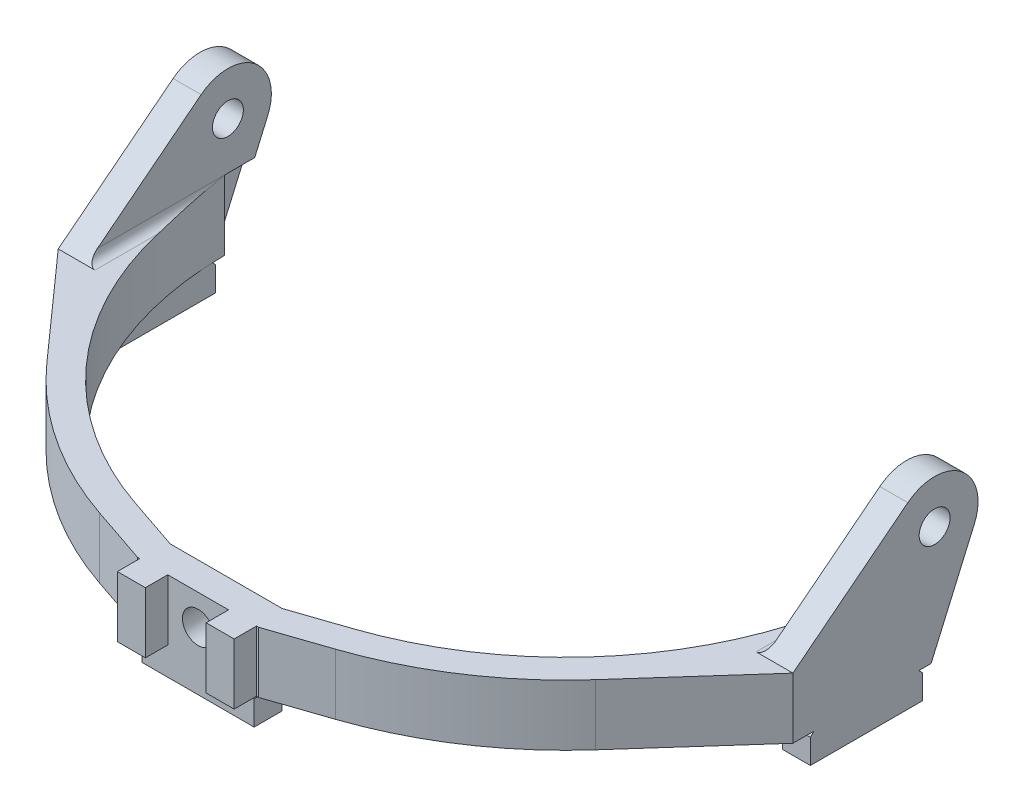
from build123d import *

# Parameters (mm, degrees)
BOSS_EXTRUDE2_DEPTH             = 6.896
SKETCH2_R                       = 1.7526
BOSS_EXTRUDE3_DEPTH             = 3.175
F_9_64_0_14063_DIAMETER_HOLE2_D = 3.572002
SKETCH9_W                       = 3.175
SKETCH9_H                       = 6.896
BOSS_EXTRUDE5_DEPTH             = 2.54
SKETCH10_W                      = 3.175
SKETCH10_H                      = 12.7
SKETCH10_W_2                    = 12.7
SKETCH10_H_2                    = 3.175
BOSS_EXTRUDE6_DEPTH             = 3.175
CUT_EXTRUDE1_DEPTH              = 97.085734956
CUT_EXTRUDE2_DEPTH              = 66.25004773
FILLET2_R                       = 1
CUT_EXTRUDE3_DEPTH              = 1


with BuildPart() as part:
    # Sketch1 → Boss-Extrude2 (new body)
    with BuildSketch(Plane(origin=(0, 0, 0), x_dir=(1, 0, 0), z_dir=(0, 1, 0))):
        with BuildLine():
            Line((12.363664128, -36.460798254), (6.35, -38.5))
            Line((6.35, -38.5), (-6.35, -38.5))
            Line((-6.35, -38.5), (-12.363664128, -36.460798254))
            ThreePointArc((-12.363664128, -36.460798254), (-27.097558937, -27.349082245), (-36.345013413, -12.7))
            ThreePointArc((-36.345013413, -12.7), (-37.940572846, -6.539337285), (-38.499480516, -0.2))
            Line((-38.499480516, -0.2), (-41.675, -0.2))
            Line((-41.675, -0.2), (-41.675, -15.875))
            Line((-41.675, -15.875), (-31.113215051, -27.726764582))
            ThreePointArc((-31.113215051, -27.726764582), (-23.009697223, -34.747078419), (-13.383265001, -39.467630318))
            Line((-13.383265001, -39.467630318), (-6.873668831, -41.675))
            Line((-6.873668831, -41.675), (6.873668831, -41.675))
            Line((6.873668831, -41.675), (13.383265001, -39.467630318))
            ThreePointArc((13.383265001, -39.467630318), (23.009697223, -34.747078419), (31.113215051, -27.726764582))
            Line((31.113215051, -27.726764582), (41.675, -15.875))
            Line((41.675, -15.875), (41.675, -0.2))
            Line((41.675, -0.2), (38.499480516, -0.2))
            ThreePointArc((38.499480516, -0.2), (37.940572846, -6.539337285), (36.345013413, -12.7))
            ThreePointArc((36.345013413, -12.7), (27.097558937, -27.349082245), (12.363664128, -36.460798254))
        make_face()
    extrude(amount=BOSS_EXTRUDE2_DEPTH)

    # Sketch2 → Boss-Extrude3 (add)
    with BuildSketch(Plane(origin=(41.675, 0, 0), x_dir=(0, 0, -1), z_dir=(1, 0, 0))):
        with BuildLine():
            Line((-15.875, 6.896), (-2.841859979, 17.12263896))
            ThreePointArc((-2.841859979, 17.12263896), (3.214674972, 17.143816898), (4.716891749, 11.27649989))
            Line((4.716891749, 11.27649989), (-0.2, 0))
            Line((-0.2, 0), (-0.2, 6.896))
            Line((-0.2, 6.896), (-15.875, 6.896))
        make_face()
        with Locations((0.2, 13.246)):
            Circle(SKETCH2_R, mode=Mode.SUBTRACT)
    boss_extrude3 = extrude(amount=-BOSS_EXTRUDE3_DEPTH)

    # Mirror1: Boss-Extrude3 across plane
    add(boss_extrude3.mirror(Plane.ZY))

    # 9/64 (0.14063) Diameter Hole2 (through all)
    with Locations(Plane.XY.offset(41.675)):
        with Locations((0, 3.448)):
            Hole(F_9_64_0_14063_DIAMETER_HOLE2_D / 2)

    # Sketch9 → Boss-Extrude5 (add)
    with BuildSketch(Plane.XY.offset(41.675)):
        with Locations((-5.0355, 3.448)):
            Rectangle(SKETCH9_W, SKETCH9_H)
        with Locations((5.0355, 3.448)):
            Rectangle(SKETCH9_W, SKETCH9_H)
    extrude(amount=BOSS_EXTRUDE5_DEPTH)

    # Sketch10 → Boss-Extrude6 (add)
    with BuildSketch(Plane(origin=(0, 0, 0), x_dir=(-1, 0, 0), z_dir=(0, -1, 0))):
        with Locations((40.0875, -7.545458209)):
            Rectangle(SKETCH10_W, SKETCH10_H)
        with Locations((-40.0875, -7.545458209)):
            Rectangle(SKETCH10_W, SKETCH10_H)
        with Locations((0, -40.0875)):
            Rectangle(SKETCH10_W_2, SKETCH10_H_2)
    extrude(amount=BOSS_EXTRUDE6_DEPTH)

    # Sketch11 → Cut-Extrude1 (cut, through all)
    with BuildSketch(Plane.ZY.offset(41.675)):
        Polygon((13.895458209, -0.4), (13.495458209, 0), (13.895458209, 0), align=None)
        Polygon((1.595458209, 0), (1.195458209, 0), (1.195458209, -0.4), align=None)
    extrude(amount=-CUT_EXTRUDE1_DEPTH, mode=Mode.SUBTRACT)

    # Sketch12 → Cut-Extrude2 (cut, through all)
    with BuildSketch(Plane.XY.offset(41.675)):
        Polygon((6.35, -0.4), (6.35, 0), (5.95, 0), align=None)
        Polygon((-5.95, 0), (-6.35, -0.4), (-6.35, 0), align=None)
    extrude(amount=-CUT_EXTRUDE2_DEPTH, mode=Mode.SUBTRACT)

    # Fillet2
    # the kernel refuses this fillet: 1 mm, written as the material it adds along each edge
    with BuildSketch(Plane(origin=(-38.5, 6.896, 0.2), x_dir=(1, 0, 0), z_dir=(0, 0, 1))) as fillet2_piece_1_section:
        with BuildLine():
            CenterArc((FILLET2_R, FILLET2_R), FILLET2_R, 180, 90)
            Line((0, FILLET2_R), (0, 0))
            Line((0, 0), (FILLET2_R, 0))
        make_face()
    fillet2_piece_1 = extrude(amount=18.175, mode=Mode.PRIVATE)
    fillet2_piece_1 = fillet2_piece_1 - Plane(origin=(0, 7.133182821, 0), x_dir=(-0.321134133185776, 0, 0.9470337208901384), z_dir=(0, -1, 0)) * Cylinder(38.5, 41, mode=Mode.PRIVATE)
    fillet2_piece_1 = split(fillet2_piece_1, bisect_by=Plane(origin=(-38.301679368, 10.067346027, 11.833340077), z_dir=(0, -0.7867194903062766, -0.617310654024562)), keep=Keep.TOP, mode=Mode.PRIVATE)
    add(fillet2_piece_1)
    with BuildSketch(Plane(origin=(38.5, 6.896, 0.2), x_dir=(-1, 0, 0), z_dir=(0, 0, 1))) as fillet2_piece_2_section:
        with BuildLine():
            CenterArc((FILLET2_R, -FILLET2_R), FILLET2_R, 90, 90)
            Line((0, -FILLET2_R), (0, 0))
            Line((0, 0), (FILLET2_R, 0))
        make_face()
    fillet2_piece_2 = extrude(amount=18.175, mode=Mode.PRIVATE)
    fillet2_piece_2 = fillet2_piece_2 - Plane(origin=(0, 7.133182807, 0), x_dir=(0.9999865069084622, 0, 0.0051948051948059485), z_dir=(0, -1, 0)) * Cylinder(38.5, 41, mode=Mode.PRIVATE)
    fillet2_piece_2 = split(fillet2_piece_2, bisect_by=Plane(origin=(38.301679263, 10.067346636, 11.833339301), z_dir=(0, -0.7867194903062766, -0.617310654024562)), keep=Keep.TOP, mode=Mode.PRIVATE)
    add(fillet2_piece_2)

    # Sketch14 → Cut-Extrude3 (cut)
    with BuildSketch(Plane(origin=(-38.5, 0, 0), x_dir=(0, 0, -1), z_dir=(1, 0, 0))):
        Polygon((-0.2, 0), (-0.2, 7.896), (3.242892532, 7.896), align=None)
    cut_extrude3 = extrude(amount=-CUT_EXTRUDE3_DEPTH, mode=Mode.SUBTRACT)

    # Mirror2: Cut-Extrude3 across plane
    add(cut_extrude3.mirror(Plane.ZY), mode=Mode.SUBTRACT)


solid = part.part
